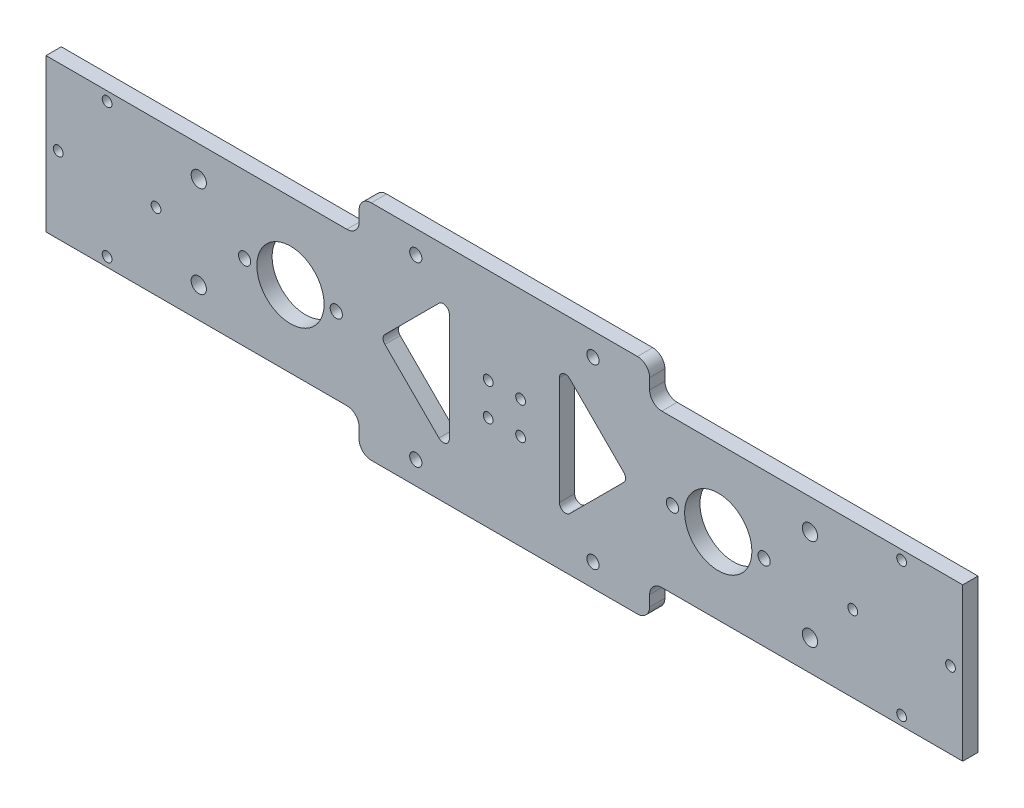
from build123d import *

# Parameters (mm, degrees)
SKETCH_1_R          = 2.1
SKETCH_1_R_2        = 1.6
SKETCH_1_R_3        = 11
SKETCH_1_R_4        = 2.5
EXTRUDE_1_DEPTH     = 5
SKETCH_2_R          = 3.689501017
SKETCH_2_R_2        = 3.294011366
EXTRUDE_2_DEPTH     = 5
CUT_EXTRUDE_1_REACH = 156.458
SKETCH_3_R          = 2
SKETCH_5_W          = 25.495020877
SKETCH_5_H          = 33.419148988
EXTRUDE_3_DEPTH     = 5
CUT_EXTRUDE_2_REACH = 156.458
SKETCH_4_R          = 2
FILLET_1_R          = 4
CUT_EXTRUDE_3_DEPTH = 10


with BuildPart() as part:
    # 草图1 → 凸台-拉伸1 (new body)
    with BuildSketch(Plane(origin=(0, 0, 0), x_dir=(-1, 0, 0), z_dir=(0, 0, -1))):
        with BuildLine():
            Line((-26.5, -36.5), (26.5, -36.5))
            ThreePointArc((26.5, -36.5), (31.295831523, -35.274964387), (34.916650165, -31.9))
            ThreePointArc((34.916650165, -31.9), (40.347878128, -26.837553419), (47.541625413, -25))
            Line((47.541625413, -25), (150, -25))
            Line((150, -25), (150, 25))
            Line((150, 25), (47.541625413, 25))
            ThreePointArc((47.541625413, 25), (40.347878128, 26.837553419), (34.916650165, 31.9))
            ThreePointArc((34.916650165, 31.9), (31.295831523, 35.274964387), (26.5, 36.5))
            Line((26.5, 36.5), (-26.5, 36.5))
            ThreePointArc((-26.5, 36.5), (-31.295831523, 35.274964387), (-34.916650165, 31.9))
            ThreePointArc((-34.916650165, 31.9), (-40.347878128, 26.837553419), (-47.541625413, 25))
            Line((-47.541625413, 25), (-150, 25))
            Line((-150, 25), (-150, -25))
            Line((-150, -25), (-47.541625413, -25))
            ThreePointArc((-47.541625413, -25), (-40.347878128, -26.837553419), (-34.916650165, -31.9))
            ThreePointArc((-34.916650165, -31.9), (-31.295831523, -35.274964387), (-26.5, -36.5))
        make_face()
        with Locations((-29, 29)):
            Circle(SKETCH_1_R, mode=Mode.SUBTRACT)
        with Locations((-29, -29)):
            Circle(SKETCH_1_R, mode=Mode.SUBTRACT)
        with Locations((29, -29)):
            Circle(SKETCH_1_R, mode=Mode.SUBTRACT)
        with Locations((29, 29)):
            Circle(SKETCH_1_R, mode=Mode.SUBTRACT)
        with Locations((-54.5, 0)):
            Circle(SKETCH_1_R, mode=Mode.SUBTRACT)
        with Locations((-114, 0)):
            Circle(SKETCH_1_R_2, mode=Mode.SUBTRACT)
        with Locations((-5.303300859, 5.303300859)):
            Circle(SKETCH_1_R_2, mode=Mode.SUBTRACT)
        with Locations((5.303300859, 5.303300859)):
            Circle(SKETCH_1_R_2, mode=Mode.SUBTRACT)
        with Locations((70, 0)):
            Circle(SKETCH_1_R_3, mode=Mode.SUBTRACT)
        with Locations((-85.5, 0)):
            Circle(SKETCH_1_R, mode=Mode.SUBTRACT)
        with Locations((85.5, 0)):
            Circle(SKETCH_1_R, mode=Mode.SUBTRACT)
        with Locations((54.5, 0)):
            Circle(SKETCH_1_R, mode=Mode.SUBTRACT)
        with Locations((-70, 0)):
            Circle(SKETCH_1_R_3, mode=Mode.SUBTRACT)
        with Locations((5.303300859, -5.303300859)):
            Circle(SKETCH_1_R_2, mode=Mode.SUBTRACT)
        with Locations((-5.303300859, -5.303300859)):
            Circle(SKETCH_1_R_2, mode=Mode.SUBTRACT)
        with Locations((114, 0)):
            Circle(SKETCH_1_R_2, mode=Mode.SUBTRACT)
        with Locations((146, 0)):
            Circle(SKETCH_1_R_2, mode=Mode.SUBTRACT)
        with Locations((130, 22)):
            Circle(SKETCH_1_R_2, mode=Mode.SUBTRACT)
        with Locations((130, -22)):
            Circle(SKETCH_1_R_2, mode=Mode.SUBTRACT)
        with Locations((-130, -22)):
            Circle(SKETCH_1_R_2, mode=Mode.SUBTRACT)
        with Locations((-130, 22)):
            Circle(SKETCH_1_R_2, mode=Mode.SUBTRACT)
        with Locations((-146, 0)):
            Circle(SKETCH_1_R_2, mode=Mode.SUBTRACT)
        with Locations((100, 15)):
            Circle(SKETCH_1_R_4, mode=Mode.SUBTRACT)
        with Locations((-100, 15)):
            Circle(SKETCH_1_R_4, mode=Mode.SUBTRACT)
        with Locations((-100, -15)):
            Circle(SKETCH_1_R_4, mode=Mode.SUBTRACT)
        with Locations((100, -15)):
            Circle(SKETCH_1_R_4, mode=Mode.SUBTRACT)
    extrude(amount=-EXTRUDE_1_DEPTH)

    # 草图2 → 凸台-拉伸2 (add)
    with BuildSketch(Plane.XY.offset(5)):
        with Locations((-85.5, 0)):
            Circle(SKETCH_2_R)
        with Locations((-54.5, 0)):
            Circle(SKETCH_2_R_2)
    extrude_2 = extrude(amount=-EXTRUDE_2_DEPTH)

    # 草图3 → 切除-拉伸1 (cut, up to next)
    with BuildSketch(Plane.XY.offset(5), mode=Mode.PRIVATE) as cut_extrude_1_sk1:
        with Locations((-85, 0)):
            Circle(SKETCH_3_R)
    cut_extrude_1_tool1 = extrude(cut_extrude_1_sk1.sketch, amount=-CUT_EXTRUDE_1_REACH, mode=Mode.PRIVATE) & part.part
    # 草图3 → 切除-拉伸1 (cut, up to next)
    with BuildSketch(Plane.XY.offset(5), mode=Mode.PRIVATE) as cut_extrude_1_sk2:
        with Locations((-55, 0)):
            Circle(SKETCH_3_R)
    cut_extrude_1_tool2 = extrude(cut_extrude_1_sk2.sketch, amount=-CUT_EXTRUDE_1_REACH, mode=Mode.PRIVATE) & part.part
    cut_extrude_1_1 = cut_extrude_1_tool1.solids().sort_by_distance((-85, 0, 5))[0]
    add(cut_extrude_1_1, mode=Mode.SUBTRACT)
    cut_extrude_1_2 = cut_extrude_1_tool2.solids().sort_by_distance((-55, 0, 5))[0]
    add(cut_extrude_1_2, mode=Mode.SUBTRACT)
    cut_extrude_1 = cut_extrude_1_1 + cut_extrude_1_2  # 切除-拉伸1 as one shape, for the pattern or mirror that repeats it

    # 镜向1: 凸台-拉伸2, 切除-拉伸1 across plane
    add(extrude_2.mirror(Plane.ZY))
    add(cut_extrude_1.mirror(Plane.ZY), mode=Mode.SUBTRACT)

    # 草图5 → 凸台-拉伸3 (add)
    with BuildSketch(Plane(origin=(0, 0, 0), x_dir=(-1, 0, 0), z_dir=(0, 0, -1))):
        Polygon((47.541625413, 25), (47.541625413, 36.5), (21.518894716, 36.5), (-47.541625413, 36.5), (-47.541625413, 25), (-47.541625413, -25), (-47.541625413, -36.5), (26.5, -36.5), (47.541625413, -36.5), (47.541625413, -25), align=None)
        with Locations((-1.313647453, -0.287111202)):
            Rectangle(SKETCH_5_W, SKETCH_5_H, mode=Mode.SUBTRACT)
    extrude(amount=-EXTRUDE_3_DEPTH)

    # 草图4 → 切除-拉伸2 (cut, up to next)
    with BuildSketch(Plane(origin=(0, 0, 0), x_dir=(-1, 0, 0), z_dir=(0, 0, -1)), mode=Mode.PRIVATE) as cut_extrude_2_sk1:
        with Locations((28.991378029, -28.991378029)):
            Circle(SKETCH_4_R)
    cut_extrude_2_tool1 = extrude(cut_extrude_2_sk1.sketch, amount=-CUT_EXTRUDE_2_REACH, mode=Mode.PRIVATE) & part.part
    # 草图4 → 切除-拉伸2 (cut, up to next)
    with BuildSketch(Plane(origin=(0, 0, 0), x_dir=(-1, 0, 0), z_dir=(0, 0, -1)), mode=Mode.PRIVATE) as cut_extrude_2_sk2:
        with Locations((-28.991378029, 28.991378029)):
            Circle(SKETCH_4_R)
    cut_extrude_2_tool2 = extrude(cut_extrude_2_sk2.sketch, amount=-CUT_EXTRUDE_2_REACH, mode=Mode.PRIVATE) & part.part
    # 草图4 → 切除-拉伸2 (cut, up to next)
    with BuildSketch(Plane(origin=(0, 0, 0), x_dir=(-1, 0, 0), z_dir=(0, 0, -1)), mode=Mode.PRIVATE) as cut_extrude_2_sk3:
        with Locations((28.991378029, 28.991378029)):
            Circle(SKETCH_4_R)
    cut_extrude_2_tool3 = extrude(cut_extrude_2_sk3.sketch, amount=-CUT_EXTRUDE_2_REACH, mode=Mode.PRIVATE) & part.part
    # 草图4 → 切除-拉伸2 (cut, up to next)
    with BuildSketch(Plane(origin=(0, 0, 0), x_dir=(-1, 0, 0), z_dir=(0, 0, -1)), mode=Mode.PRIVATE) as cut_extrude_2_sk4:
        with Locations((-28.991378029, -28.991378029)):
            Circle(SKETCH_4_R)
    cut_extrude_2_tool4 = extrude(cut_extrude_2_sk4.sketch, amount=-CUT_EXTRUDE_2_REACH, mode=Mode.PRIVATE) & part.part
    add(cut_extrude_2_tool1.solids().sort_by_distance((-28.991378, -28.991378, 0))[0], mode=Mode.SUBTRACT)
    add(cut_extrude_2_tool2.solids().sort_by_distance((28.991378, 28.991378, 0))[0], mode=Mode.SUBTRACT)
    add(cut_extrude_2_tool3.solids().sort_by_distance((-28.991378, 28.991378, 0))[0], mode=Mode.SUBTRACT)
    add(cut_extrude_2_tool4.solids().sort_by_distance((28.991378, -28.991378, 0))[0], mode=Mode.SUBTRACT)

    # 圆角1
    fillet_1_edges = [part.edges().sort_by_distance(p)[0] for p in [
        (47.541625413, -25, 2.5),
        (47.541625413, -36.5, 2.5),
        (-47.541625413, -36.5, 2.5),
        (-47.541625413, -25, 2.5),
        (-47.541625413, 25, 2.5),
        (-47.541625413, 36.5, 2.5),
        (47.541625413, 25, 2.5),
        (47.541625413, 36.5, 2.5),
    ]]
    fillet(fillet_1_edges, radius=FILLET_1_R)

    # 草图6 → 切除-拉伸3 (cut)
    with BuildSketch(Plane(origin=(0, 0, 0), x_dir=(-1, 0, 0), z_dir=(0, 0, -1))):
        with BuildLine():
            Line((-21.414213562, 19.085786438), (-39.085786438, 1.414213562))
            ThreePointArc((-39.085786438, 1.414213562), (-39.671572875, 0), (-39.085786438, -1.414213562))
            Line((-39.085786438, -1.414213562), (-21.414213562, -19.085786438))
            ThreePointArc((-21.414213562, -19.085786438), (-19.234633135, -19.51933194), (-18, -17.671572875))
            Line((-18, -17.671572875), (-18, 17.671572875))
            ThreePointArc((-18, 17.671572875), (-19.234633135, 19.51933194), (-21.414213562, 19.085786438))
        make_face()
        with BuildLine():
            Line((18, -17.671572875), (18, 17.671572875))
            ThreePointArc((18, 17.671572875), (19.234633135, 19.51933194), (21.414213562, 19.085786438))
            Line((21.414213562, 19.085786438), (39.085786438, 1.414213562))
            ThreePointArc((39.085786438, 1.414213562), (39.671572875, 0), (39.085786438, -1.414213562))
            Line((39.085786438, -1.414213562), (21.414213562, -19.085786438))
            ThreePointArc((21.414213562, -19.085786438), (19.234633135, -19.51933194), (18, -17.671572875))
        make_face()
    extrude(amount=-CUT_EXTRUDE_3_DEPTH, mode=Mode.SUBTRACT)


solid = part.part
